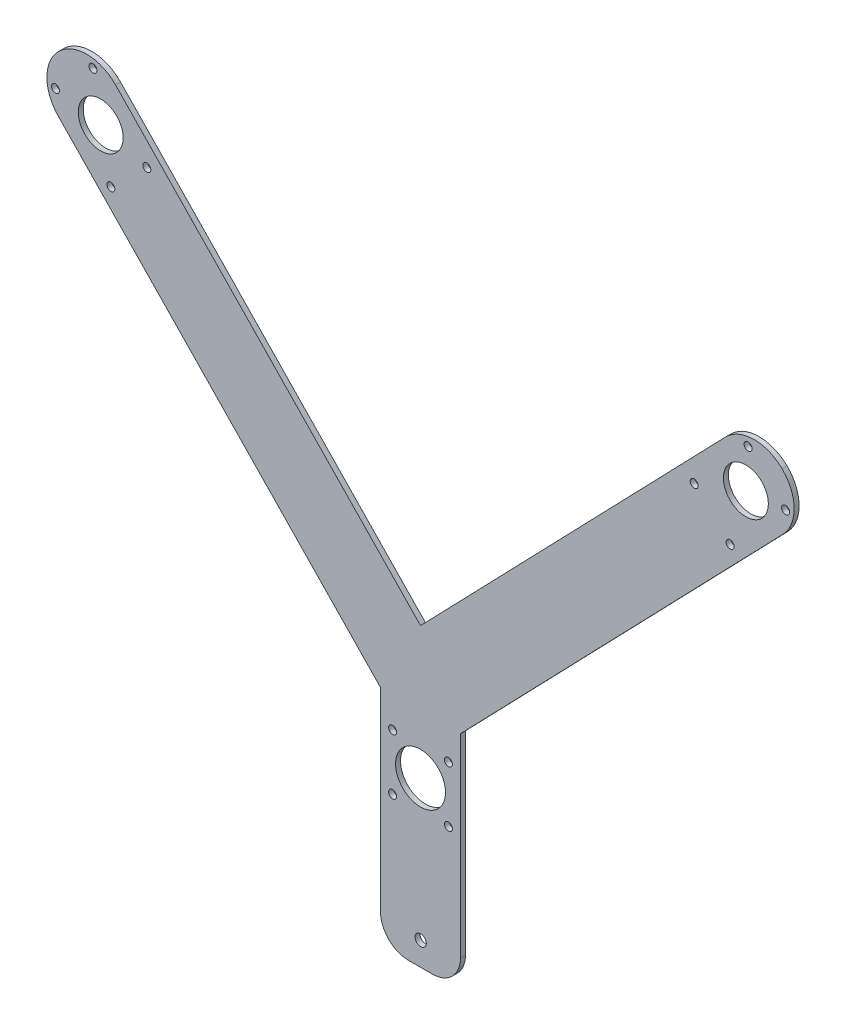
from build123d import *

# Parameters (mm, degrees)
BOSS_EXTRUDE1_DEPTH = 3.175
SKETCH2_R           = 14.2875
SKETCH2_R_2         = 15.875
SKETCH2_R_3         = 2.54
CUT_EXTRUDE1_DEPTH  = 491.500657373
FILLET1_R           = 25.4
SKETCH7_R           = 3.556
CUT_EXTRUDE6_DEPTH  = 476.917284882
FILLET2_R           = 17.78
FILLET3_R           = 17.78
SKETCH9_R           = 2.54
CUT_EXTRUDE7_DEPTH  = 476.917284882


with BuildPart() as part:
    # Sketch1 → Boss-Extrude1 (new body)
    with BuildSketch(Plane.XY):
        Polygon((0, 0), (50.8, 0), (50.8, 141.300925348), (273.474793589, 371.887424227), (236.932331732, 407.176069446), (25.4, 188.127927591), (-186.132331732, 407.176069446), (-222.674793589, 371.887424227), (0, 141.300925348), align=None)
    extrude(amount=BOSS_EXTRUDE1_DEPTH)

    # Sketch2 → Cut-Extrude1 (cut, through all)
    with BuildSketch(Plane.XY.offset(3.175)):
        with Locations((232.265943268, 365.779146629)):
            Circle(SKETCH2_R)
        with Locations((-177.937078746, 362.124900444)):
            Circle(SKETCH2_R)
        with Locations((25.4, 104.14)):
            Circle(SKETCH2_R_2)
        with Locations((43.1292, 121.8692)):
            Circle(SKETCH2_R_3)
        with Locations((7.6708, 121.8692)):
            Circle(SKETCH2_R_3)
        with Locations((7.6708, 86.4108)):
            Circle(SKETCH2_R_3)
        with Locations((43.1292, 86.4108)):
            Circle(SKETCH2_R_3)
    extrude(amount=-CUT_EXTRUDE1_DEPTH, mode=Mode.SUBTRACT)

    # Fillet1
    fillet1_edges = [part.edges().sort_by_distance(p)[0] for p in [
        (273.474793589, 371.887424227, 1.5875),
        (236.932331732, 407.176069446, 1.5875),
        (-222.674793589, 371.887424227, 1.5875),
        (-186.132331732, 407.176069446, 1.5875),
    ]]
    fillet(fillet1_edges, radius=FILLET1_R - 0.0001)  # a hair under: the kernel refuses the full size

    # Sketch7 → Cut-Extrude6 (cut, through all)
    with BuildSketch(Plane(origin=(0, 0, 0), x_dir=(-1, 0, 0), z_dir=(0, 0, -1))):
        with Locations((-25.507732434, 14.949579081)):
            Circle(SKETCH7_R)
    extrude(amount=-CUT_EXTRUDE6_DEPTH, mode=Mode.SUBTRACT)

    # Fillet2
    fillet2_edges = [part.edges().sort_by_distance(p)[0] for p in [
        (0, 0, 1.5875),
    ]]
    fillet(fillet2_edges, radius=FILLET2_R)

    # Fillet3
    fillet3_edges = [part.edges().sort_by_distance(p)[0] for p in [
        (50.8, 0, 1.5875),
    ]]
    fillet(fillet3_edges, radius=FILLET3_R)

    # Sketch9 → Cut-Extrude7 (cut, through all)
    with BuildSketch(Plane(origin=(0, 0, 0), x_dir=(-1, 0, 0), z_dir=(0, 0, -1))):
        with Locations((-233.698211642, 390.878637547)):
            Circle(SKETCH9_R)
        with Locations((-257.542931638, 367.852059109)):
            Circle(SKETCH9_R)
        with Locations((-199.415247758, 353.365000514)):
            Circle(SKETCH9_R)
        with Locations((-222.254286418, 331.309597252)):
            Circle(SKETCH9_R)
    cut_extrude7 = extrude(amount=-CUT_EXTRUDE7_DEPTH, mode=Mode.SUBTRACT)

    # Mirror3: Cut-Extrude7 across plane
    add(cut_extrude7.mirror(Plane.ZY.offset(-25.4)), mode=Mode.SUBTRACT)


solid = part.part
